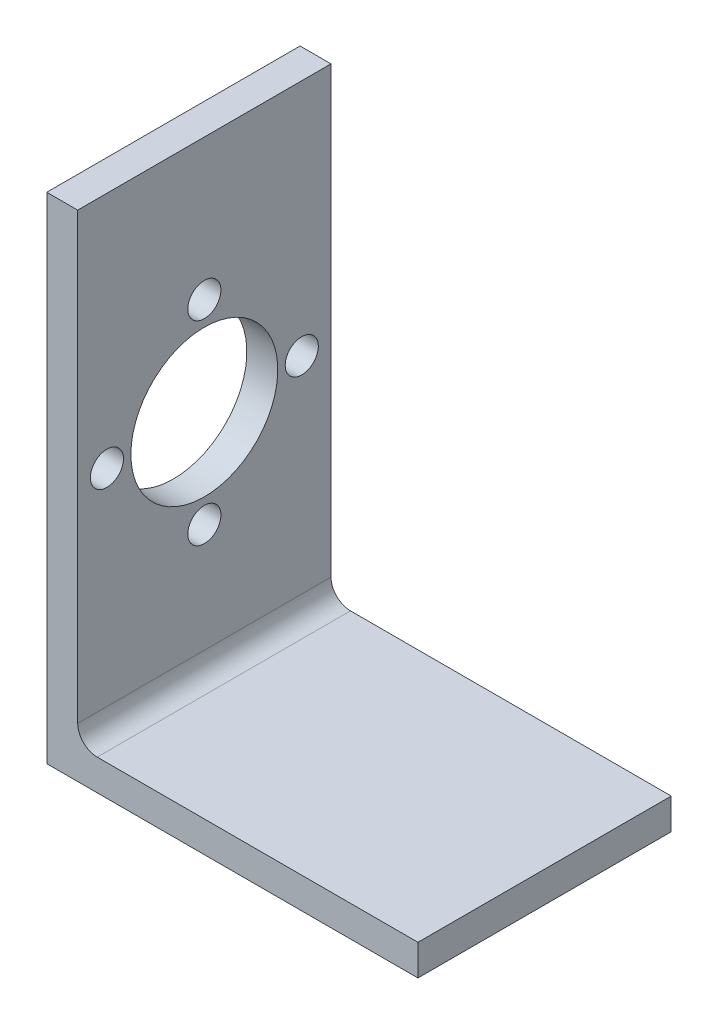
from build123d import *

# Parameters (mm, degrees)
BOSS_EXTRUDE1_DEPTH  = 13
FILLET1_R            = 2
M3_CLEARANCE_HOLE1_D = 3.4
SKETCH6_R            = 7.54
CUT_EXTRUDE1_DEPTH   = 65.817050226


with BuildPart() as part:
    # Sketch1 → Boss-Extrude1 (new, symmetric)
    with BuildSketch(Plane.XY):
        Polygon((0, 0), (0, 50.8), (3.175, 50.8), (3.175, 3.175), (38.1, 3.175), (38.1, 0), align=None)
    extrude(amount=BOSS_EXTRUDE1_DEPTH, both=True)

    # Fillet1
    fillet1_edges = [part.edges().sort_by_distance(p)[0] for p in [
        (3.175, 3.175, 0),
    ]]
    fillet(fillet1_edges, radius=FILLET1_R)

    # M3 Clearance Hole1 (through all)
    with Locations(Plane.ZY):
        with Locations((0, 36.35), (10, 26.35), (-10, 26.35), (0, 16.35)):
            Hole(M3_CLEARANCE_HOLE1_D / 2)

    # Sketch6 → Cut-Extrude1 (cut, through all)
    with BuildSketch(Plane.ZY):
        with Locations((0, 26.35)):
            Circle(SKETCH6_R)
    extrude(amount=-CUT_EXTRUDE1_DEPTH, mode=Mode.SUBTRACT)


solid = part.part
